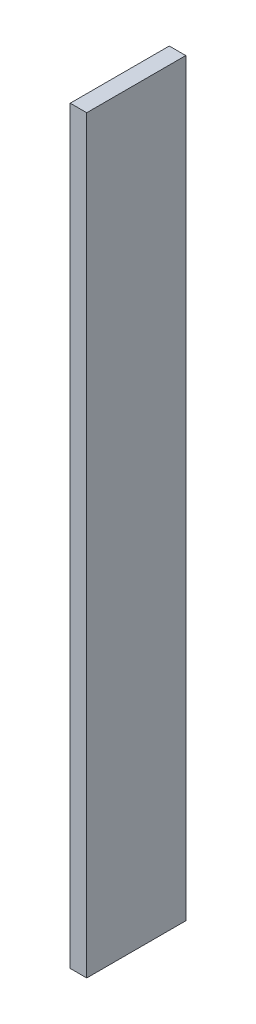
from build123d import *

# Parameters (mm, degrees)
SKETCH_1_W      = 5
SKETCH_1_H      = 30
EXTRUDE_1_DEPTH = 227


with BuildPart() as part:
    # Эскиз1 → Бобышка-Вытянуть1 (new body)
    with BuildSketch(Plane(origin=(0, 0, 0), x_dir=(1, 0, 0), z_dir=(0, 1, 0))):
        with Locations((2.5, -15)):
            Rectangle(SKETCH_1_W, SKETCH_1_H)
    extrude(amount=EXTRUDE_1_DEPTH)


solid = part.part
